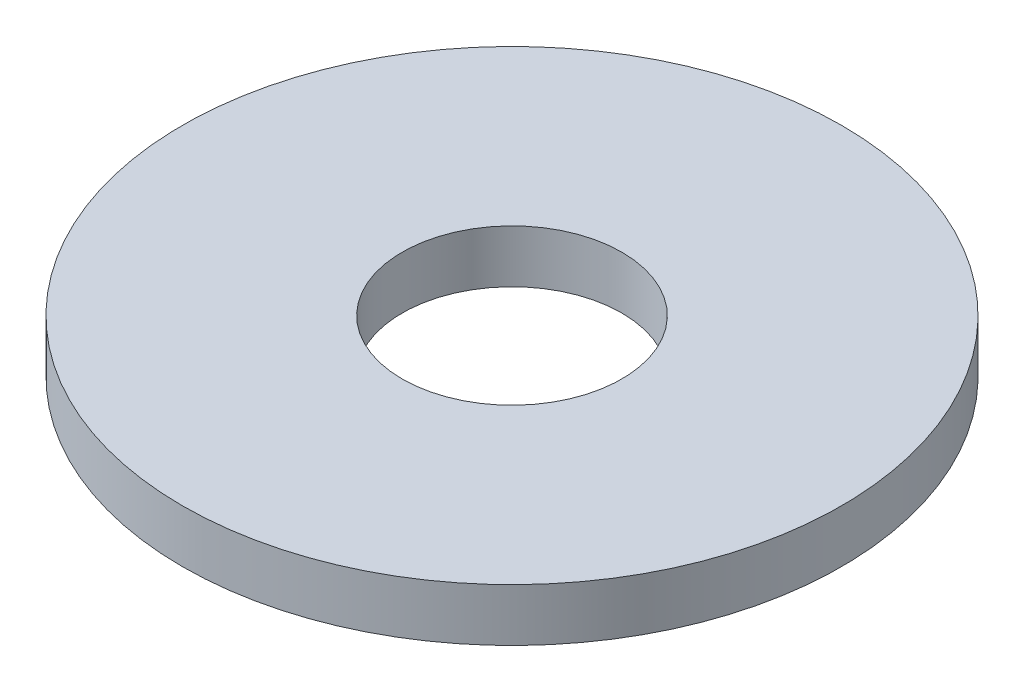
from build123d import *

# Parameters (mm, degrees)
SKETCH1_R           = 75
BOSS_EXTRUDE1_DEPTH = 12
SKETCH2_R           = 25
CUT_EXTRUDE1_DEPTH  = 107.742681248


with BuildPart() as part:
    # Sketch1 → Boss-Extrude1 (new body)
    with BuildSketch(Plane(origin=(0, 0, 0), x_dir=(1, 0, 0), z_dir=(0, 1, 0))):
        Circle(SKETCH1_R)
    extrude(amount=BOSS_EXTRUDE1_DEPTH)

    # Sketch2 → Cut-Extrude1 (cut, through all)
    with BuildSketch(Plane(origin=(0, 0, 0), x_dir=(1, 0, 0), z_dir=(0, 1, 0))):
        Circle(SKETCH2_R)
    extrude(amount=CUT_EXTRUDE1_DEPTH, mode=Mode.SUBTRACT)


solid = part.part
